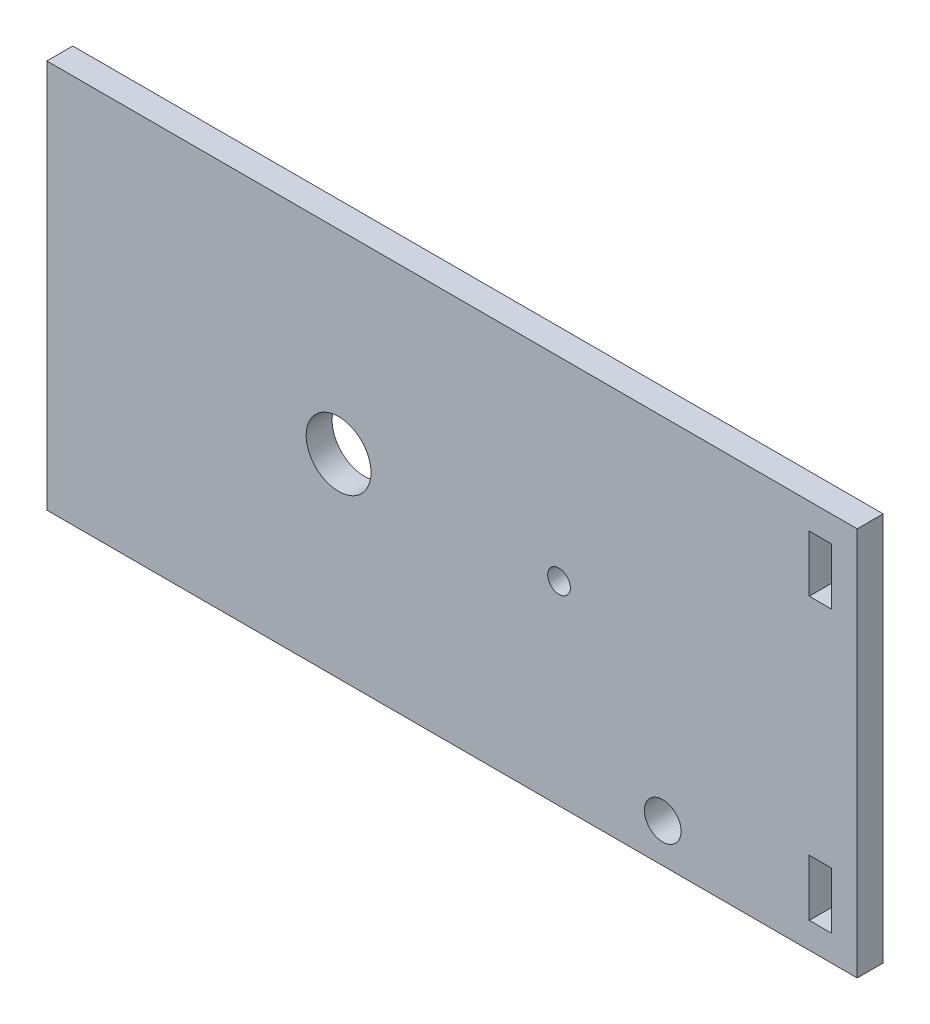
from build123d import *

# Parameters (mm, degrees)
SKETCH1_W               = 121
SKETCH1_H               = 60
SKETCH1_R               = 5
SKETCH1_R_2             = 2.83
BOSS_EXTRUDE1_DEPTH     = 4
SKETCH2_W               = 4
SKETCH2_H               = 60
BOSS_EXTRUDE2_DEPTH     = 4
CUT_EXTRUDE1_DEPTH      = 87.469647854
CUT_EXTRUDE1_DEPTH_BACK = 87.469647854
SKETCH3_R               = 1.75
SKETCH3_W               = 3.4
SKETCH3_H               = 8.7


with BuildPart() as part:
    # Sketch1 → Boss-Extrude1 (new body)
    with BuildSketch(Plane.XY):
        with Locations((-20.5, 0)):
            Rectangle(SKETCH1_W, SKETCH1_H)
        with Locations((-36, 0)):
            Circle(SKETCH1_R, mode=Mode.SUBTRACT)
        with Locations((14, -24)):
            Circle(SKETCH1_R_2, mode=Mode.SUBTRACT)
    extrude(amount=BOSS_EXTRUDE1_DEPTH)

    # Sketch2 → Boss-Extrude2 (add)
    with BuildSketch(Plane.XY):
        with Locations((42, 0)):
            Rectangle(SKETCH2_W, SKETCH2_H)
    extrude(amount=BOSS_EXTRUDE2_DEPTH)

    # Sketch3 → Cut-Extrude1 (cut, two sides: drawn at the far end of the back side and taken through both)
    with BuildSketch(Plane.XY.offset(-CUT_EXTRUDE1_DEPTH_BACK)):
        with Locations((-2, 0)):
            Circle(SKETCH3_R)
        with Locations((38.3, 21.65)):
            Rectangle(SKETCH3_W, SKETCH3_H)
        with Locations((38.3, -21.65)):
            Rectangle(SKETCH3_W, SKETCH3_H)
    extrude(amount=CUT_EXTRUDE1_DEPTH + CUT_EXTRUDE1_DEPTH_BACK, mode=Mode.SUBTRACT)


solid = part.part
